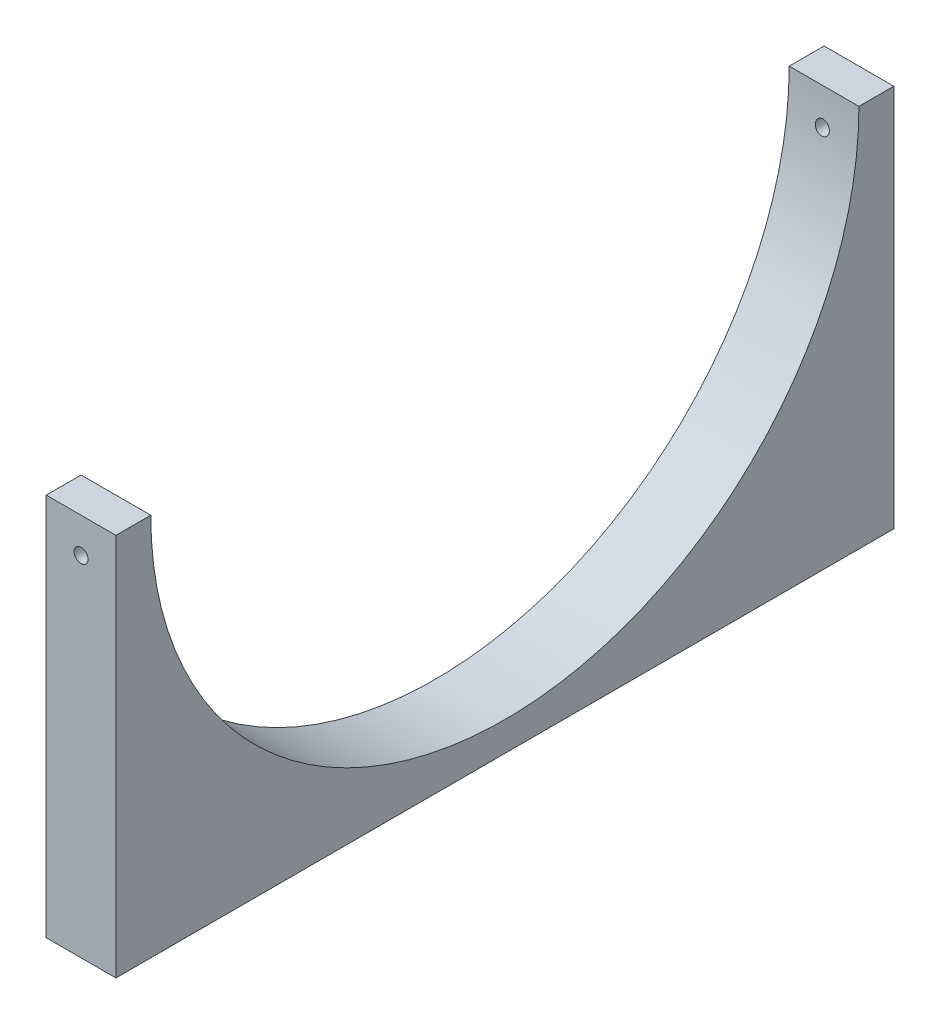
from build123d import *

# Parameters (mm, degrees)
SKETCH1_W               = 189.5
SKETCH1_H               = 111.6
BOSS_EXTRUDE1_DEPTH     = 80
SKETCH3_R               = 8.15
CUT_EXTRUDE2_DEPTH      = 40
SKETCH4_R               = 10.3
CUT_EXTRUDE3_DEPTH      = 40
CUT_EXTRUDE1_DEPTH      = 214.674688487
CUT_EXTRUDE5_START      = -10
SKETCH5_R               = 83.637561864
CUT_EXTRUDE5_DEPTH      = 196.625563976
SKETCH6_R               = 2
CUT_EXTRUDE6_DEPTH      = 15
CUT_EXTRUDE7_DEPTH      = 142.983674128
CUT_EXTRUDE7_DEPTH_BACK = 142.983674128
SKETCH7_R               = 1


with BuildPart() as part:
    # Sketch1 → Boss-Extrude1 (new body)
    with BuildSketch(Plane(origin=(0, 0, 0), x_dir=(1, 0, 0), z_dir=(0, 1, 0))):
        with Locations((26.340909091, -2.05)):
            Rectangle(SKETCH1_W, SKETCH1_H)
    extrude(amount=BOSS_EXTRUDE1_DEPTH)

    # Sketch3 → Cut-Extrude2 (cut)
    with BuildSketch(Plane.XY.offset(57.85)):
        with Locations((-6.709090909, 45)):
            Circle(SKETCH3_R)
        with Locations((44.290909091, 45)):
            Circle(SKETCH3_R)
        with Locations((95.290909091, 45)):
            Circle(SKETCH3_R)
    extrude(amount=-CUT_EXTRUDE2_DEPTH, mode=Mode.SUBTRACT)

    # Sketch4 → Cut-Extrude3 (cut)
    with BuildSketch(Plane(origin=(0, 0, -53.75), x_dir=(-1, 0, 0), z_dir=(0, 0, -1))):
        with Locations((-18.790909091, 45)):
            Circle(SKETCH4_R)
    extrude(amount=-CUT_EXTRUDE3_DEPTH, mode=Mode.SUBTRACT)

    # Sketch2 → Cut-Extrude1 (cut, through all)
    with BuildSketch(Plane.ZY.offset(68.409090909)):
        with BuildLine():
            Line((-53.75, 80), (-53.75, 55))
            Line((-53.75, 55), (-48.75, 55))
            ThreePointArc((-48.75, 55), (2.05, 4.2), (52.85, 55))
            Line((52.85, 55), (57.85, 55))
            Line((57.85, 55), (57.85, 80))
            Line((57.85, 80), (-53.75, 80))
        make_face()
    extrude(amount=-CUT_EXTRUDE1_DEPTH, mode=Mode.SUBTRACT)

    # Sketch5 → Cut-Extrude5 (cut, through all)
    with BuildSketch(Plane.ZY.offset(68.409090909).offset(CUT_EXTRUDE5_START)):
        with Locations((5.899408019, 41.151011042)):
            Circle(SKETCH5_R)
    extrude(amount=-CUT_EXTRUDE5_DEPTH, mode=Mode.SUBTRACT)

    # Sketch6 → Cut-Extrude6 (cut)
    with BuildSketch(Plane.XZ):
        with Locations((-63.409090909, 42.85)):
            Circle(SKETCH6_R)
        with Locations((-63.409090909, -38.75)):
            Circle(SKETCH6_R)
    extrude(amount=-CUT_EXTRUDE6_DEPTH, mode=Mode.SUBTRACT)

    # Sketch7 → Cut-Extrude7 (cut, two sides: drawn at the far end of the back side and taken through both)
    with BuildSketch(Plane.XY.offset(57.85).offset(-CUT_EXTRUDE7_DEPTH_BACK)):
        with Locations((-63.409090909, 50)):
            Circle(SKETCH7_R)
    extrude(amount=CUT_EXTRUDE7_DEPTH + CUT_EXTRUDE7_DEPTH_BACK, mode=Mode.SUBTRACT)


solid = part.part
